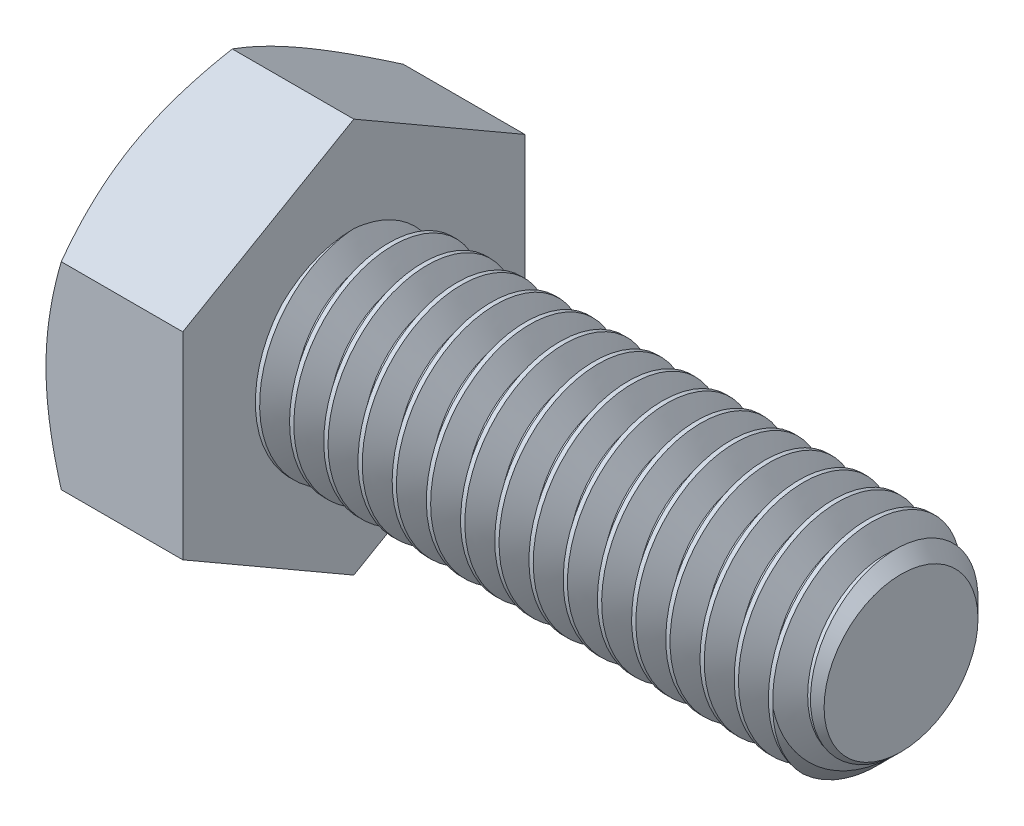
from build123d import *

# Parameters (mm, degrees)
SKETCH2_R           = 3
BOSS_EXTRUDE1_DEPTH = 16
CHAMFER1_SIZE       = 0.75
CUT_SWEEP1_PITCH    = 1
BOSS_EXTRUDE2_DEPTH = 4
SKETCH6_OUTSIDE_W   = 94.66
SKETCH6_OUTSIDE_H   = 96.208
SKETCH6_OUTSIDE_R   = 5
CUT_EXTRUDE1_DEPTH  = 22.408721108
CUT_EXTRUDE1_DRAFT  = -60
SKETCH7_W           = 0.197562976
SKETCH7_H           = 0.197562976
CUT_EXTRUDE2_DEPTH  = 0.5


with BuildPart() as part:
    # Sketch2 → Boss-Extrude1 (new body)
    with BuildSketch(Plane(origin=(10, 0, 0), x_dir=(0, 0, -1), z_dir=(1, 0, 0))):
        Circle(SKETCH2_R)
    extrude(amount=-BOSS_EXTRUDE1_DEPTH)

    # Chamfer1
    chamfer1_edges = [part.edges().sort_by_distance(p)[0] for p in [
        (10, 0, 3),
    ]]
    chamfer(chamfer1_edges, length=CHAMFER1_SIZE)

    # Cut-Sweep1: arcs per turn and ends read off the stored shape
    # Cut-Sweep1: the profile of Sketch5 profile screwed along a right-hand helix through 17 turns, 8 arcs to a turn; built about Z, then put on its axis
    cut_sweep1_z = Axis((0, 0, 0), (0, 0, 1))
    cut_sweep1_corners = [(3.0003, 0, 0.000173205), (2.350480947, 0, -0.375), (2.350480947, 0, -0.5), (3.0003, 0, -0.875173205)]
    with BuildLine(mode=Mode.PRIVATE) as cut_sweep1_profile:
        Line(cut_sweep1_corners[0], cut_sweep1_corners[1])
        Line(cut_sweep1_corners[1], cut_sweep1_corners[2])
        Line(cut_sweep1_corners[2], cut_sweep1_corners[3])
        Line(cut_sweep1_corners[3], cut_sweep1_corners[0])
    cut_sweep1_cap = Face(cut_sweep1_profile.wire())
    cut_sweep1_turn_angles = [0, 22.5, 45, 67.5, 90, 112.5, 135, 157.5, 180, 202.5, 225, 247.5, 270, 292.5, 315, 337.5, 360]
    cut_sweep1_turn_weights = [1, 0.9238795325112867, 1, 0.9238795325112867, 1, 0.9238795325112867, 1, 0.9238795325112867, 1, 0.9238795325112867, 1, 0.9238795325112867, 1, 0.9238795325112867, 1, 0.9238795325112867, 1]
    cut_sweep1_turn_rails = [Edge.make_bspline([Vector(p[0], p[1], 0).rotate(cut_sweep1_z, cut_sweep1_turn_angles[k]) / cut_sweep1_turn_weights[k] + Vector(0, 0, p[2] + CUT_SWEEP1_PITCH * cut_sweep1_turn_angles[k] / 360) for k in range(17)], [0, 0, 0, 1, 1, 2, 2, 3, 3, 4, 4, 5, 5, 6, 6, 7, 7, 8, 8, 8], 2, cut_sweep1_turn_weights) for p in cut_sweep1_corners]
    cut_sweep1_turn_sides = [Face.make_surface_from_curves(cut_sweep1_turn_rails[p[0]], cut_sweep1_turn_rails[p[1]]) for p in [(0, 1), (1, 2), (2, 3), (3, 0)]]
    cut_sweep1 = Plane(origin=(10, 0, 0), x_dir=(0, 1, 0), z_dir=(-1, 0, 0)) * Solid(Shell([*[p.moved(Location((0, 0, CUT_SWEEP1_PITCH * i))) for i in range(17) for p in cut_sweep1_turn_sides], cut_sweep1_cap, cut_sweep1_cap.rotate(cut_sweep1_z, 6120).moved(Location((0, 0, CUT_SWEEP1_PITCH * 6120 / 360)))]))
    add(cut_sweep1, mode=Mode.SUBTRACT)

    # Sketch3 → Boss-Extrude2 (add)
    with BuildSketch(Plane.ZY.offset(6)):
        Polygon((-5, -2.886751346), (0, -5.773502692), (5, -2.886751346), (5, 2.886751346), (0, 5.773502692), (-5, 2.886751346), align=None)
    extrude(amount=BOSS_EXTRUDE2_DEPTH)


with BuildPart() as cut_extrude1_tool:
    # Sketch6 outside → Cut-Extrude1 (with draft: the straight prism first)
    with BuildSketch(Plane.ZY.offset(10)):
        Rectangle(SKETCH6_OUTSIDE_W, SKETCH6_OUTSIDE_H)
        Circle(SKETCH6_OUTSIDE_R, mode=Mode.SUBTRACT)
    extrude(amount=-CUT_EXTRUDE1_DEPTH)
    # Cut-Extrude1: the draft: its side faces are tilted about the plane it starts from
    cut_extrude1_sides = [cut_extrude1_tool.faces().sort_by_distance(p)[0] for p in [
        (1.204360554, -48.104, 0),
        (1.204360554, 0, 47.33),
        (1.204360554, 48.104, 0),
        (1.204360554, 0, -47.33),
        (1.204360554, 0, -5),
    ]]
    draft(cut_extrude1_sides, Plane.ZY.offset(10), CUT_EXTRUDE1_DRAFT)


with BuildPart() as part_1:
    add(part.part)

    # Cut-Extrude1: cut by cut_extrude1_tool
    add(cut_extrude1_tool.part, mode=Mode.SUBTRACT)

    # Sketch7 → Cut-Extrude2 (cut)
    # profile 1 of 4: a face of its own
    with BuildSketch(Plane.ZY.offset(10)):
        with BuildLine():
            Line((-1.284159342, 2.5), (-1.481722318, 2.5))
            Line((-1.481722318, 2.5), (-1.481722318, 3.700812462))
            add(Edge.make_bspline(
                [(-1.481722318, 3.700812462), (-1.493098012, 3.689842005), (-1.516741144, 3.667041113), (-1.556707362, 3.634772156), (-1.601314769, 3.602066201), (-1.649984109, 3.570615769), (-1.699594268, 3.541008578), (-1.7475361, 3.514381463), (-1.793009194, 3.491848462), (-1.822962567, 3.479527328), (-1.837335675, 3.47361504)],
                knots=[0, 0, 0, 0, 0.893362401, 1.856755847, 2.901947673, 4.020460078, 5.132200827, 6.168787962, 7.121294059, 8, 8, 8, 8], degree=3))
            Line((-1.837335675, 3.47361504), (-1.837335675, 3.655743408))
            add(Edge.make_bspline(
                [(-1.837335675, 3.655743408), (-1.812648378, 3.668457416), (-1.763991177, 3.693515971), (-1.695249075, 3.736795542), (-1.631070927, 3.783712378), (-1.572519137, 3.834256092), (-1.520031188, 3.885920841), (-1.475798832, 3.938052602), (-1.438788011, 3.98874045), (-1.42021898, 4.024089603), (-1.411340508, 4.040991211)],
                knots=[0, 0, 0, 0, 1.141258006, 2.249351951, 3.335817539, 4.406819942, 5.426913362, 6.360259544, 7.215985427, 8, 8, 8, 8], degree=3))
            Line((-1.411340508, 4.040991211), (-1.284159342, 4.040991211))
            Line((-1.284159342, 4.040991211), (-1.284159342, 2.5))
        make_face()
    # profile 2 of 4: a face of its own
    with BuildSketch(Plane.ZY.offset(10)):
        with BuildLine():
            add(Edge.make_bspline(
                [(-0.790251903, 3.260000072), (-0.790052858, 3.282022251), (-0.789663013, 3.325154426), (-0.787244933, 3.388264546), (-0.783023159, 3.448197614), (-0.776721214, 3.50490158), (-0.769258531, 3.558504437), (-0.759556995, 3.608929689), (-0.748641356, 3.656290471), (-0.735544549, 3.700537418), (-0.721155446, 3.742050974), (-0.704830549, 3.780764541), (-0.686462825, 3.816637074), (-0.666954934, 3.85004059), (-0.645279941, 3.880455529), (-0.622746104, 3.908735457), (-0.597715799, 3.933843239), (-0.57122984, 3.956424902), (-0.542898213, 3.976351902), (-0.512870822, 3.993546501), (-0.481263204, 4.008728091), (-0.447472952, 4.020156788), (-0.412201546, 4.029473599), (-0.375177484, 4.036327159), (-0.336359967, 4.040367563), (-0.309833651, 4.04078098), (-0.296344464, 4.040991211)],
                knots=[0, 0, 0, 0, 1.514747001, 2.966751498, 4.343369068, 5.64627492, 6.890416844, 8.064737671, 9.177176366, 10.232018008, 11.237056675, 12.19799043, 13.119080079, 14.007588942, 14.855863561, 15.685992447, 16.491747269, 17.290132607, 18.077525251, 18.870243746, 19.668095604, 20.485086593, 21.319398728, 22.175900658, 23.072407314, 24, 24, 24, 24], degree=3))
            add(Edge.make_bspline(
                [(-0.296344464, 4.040991211), (-0.276554072, 4.040409387), (-0.237675053, 4.039266372), (-0.180911485, 4.029944144), (-0.127415481, 4.013997036), (-0.077221797, 3.992483699), (-0.031188485, 3.965157621), (0.009921203, 3.93193861), (0.045663832, 3.893175459), (0.075649327, 3.848408838), (0.101859643, 3.798873708), (0.125144312, 3.744347738), (0.146192977, 3.68489203), (0.161129567, 3.631670872), (0.171783825, 3.585728479), (0.178836097, 3.547836494), (0.184690897, 3.506950828), (0.189176465, 3.463170395), (0.192856768, 3.416544299), (0.195698897, 3.36704351), (0.197141568, 3.314544309), (0.197419873, 3.278522328), (0.197562976, 3.260000072)],
                knots=[0, 0, 0, 0, 1.134486744, 2.228744715, 3.287356444, 4.328707449, 5.352829806, 6.347195599, 7.349461267, 8.364207941, 9.428085653, 10.559314403, 11.761222316, 13.04268526, 13.726896727, 14.465273606, 15.252205015, 16.094778733, 16.988606776, 17.934225168, 18.937792761, 20, 20, 20, 20], degree=3))
            add(Edge.make_bspline(
                [(0.197562976, 3.260000072), (0.197360203, 3.238081335), (0.196964045, 3.195258767), (0.194610758, 3.132654684), (0.190134593, 3.073173782), (0.184626591, 3.016679807), (0.176294137, 2.963323573), (0.167315467, 2.912878383), (0.156211069, 2.865573301), (0.143254845, 2.821387596), (0.128663193, 2.78008763), (0.11266119, 2.74136128), (0.094937435, 2.705235008), (0.074964401, 2.672061172), (0.053655947, 2.641399446), (0.03085601, 2.613134809), (0.006081205, 2.587674071), (-0.020643434, 2.565160142), (-0.048776137, 2.544879764), (-0.07887653, 2.527515404), (-0.110812868, 2.513129332), (-0.144371773, 2.500829956), (-0.179893749, 2.491817695), (-0.217098671, 2.484918949), (-0.256123623, 2.480856468), (-0.282752541, 2.480450776), (-0.296344464, 2.480243702)],
                knots=[0, 0, 0, 0, 1.508974709, 2.94807912, 4.311757619, 5.615040294, 6.854280449, 8.028314546, 9.141715822, 10.197470207, 11.196696834, 12.155719058, 13.080757287, 13.963948316, 14.818758719, 15.649605906, 16.461113142, 17.260189315, 18.052359509, 18.845763934, 19.647754795, 20.461145776, 21.303032214, 22.167241874, 23.064524267, 24, 24, 24, 24], degree=3))
            add(Edge.make_bspline(
                [(-0.296344464, 2.480243702), (-0.31416505, 2.480752036), (-0.348910289, 2.481743145), (-0.399653148, 2.488477126), (-0.447278028, 2.500329248), (-0.492186617, 2.516224614), (-0.533874131, 2.537485582), (-0.572539611, 2.563353701), (-0.608960011, 2.593227122), (-0.629925808, 2.616796566), (-0.64053621, 2.628724626)],
                knots=[0, 0, 0, 0, 1.10322584, 2.150986741, 3.161425019, 4.136713905, 5.093944212, 6.049774532, 7.013026876, 8, 8, 8, 8], degree=3))
            add(Edge.make_bspline(
                [(-0.64053621, 2.628724626), (-0.652749028, 2.646341795), (-0.677932381, 2.682669151), (-0.707407312, 2.744610663), (-0.733699472, 2.81279957), (-0.754333998, 2.888573732), (-0.770495975, 2.971330072), (-0.782168957, 3.061230974), (-0.788774716, 3.158237599), (-0.789748392, 3.225313505), (-0.790251903, 3.260000072)],
                knots=[0, 0, 0, 0, 0.779365345, 1.607084704, 2.489375761, 3.438383567, 4.461919411, 5.557722155, 6.737039282, 8, 8, 8, 8], degree=3))
        make_face()
        with BuildLine():
            add(Edge.make_bspline(
                [(-0.592688927, 3.260617457), (-0.592492763, 3.230978591), (-0.592117261, 3.174243246), (-0.588194178, 3.093187016), (-0.581440751, 3.020063233), (-0.57251228, 2.954973141), (-0.560723083, 2.897828693), (-0.545920352, 2.84877551), (-0.529234153, 2.807224843), (-0.508585298, 2.77369168), (-0.485977083, 2.746357261), (-0.462635646, 2.722848776), (-0.438011843, 2.702867102), (-0.412266343, 2.686206461), (-0.384999685, 2.673592119), (-0.356510025, 2.664449215), (-0.326791165, 2.659187614), (-0.30655127, 2.658431621), (-0.296344464, 2.658050381)],
                knots=[0, 0, 0, 0, 1.89448813, 3.626469325, 5.185477471, 6.587276848, 7.82441448, 8.910550357, 9.859733512, 10.6775885, 11.416198291, 12.123144072, 12.791880183, 13.439617036, 14.078171869, 14.70637855, 15.347637704, 16, 16, 16, 16], degree=3))
            add(Edge.make_bspline(
                [(-0.296344464, 2.658050381), (-0.286140213, 2.658439952), (-0.265905387, 2.659212463), (-0.236117858, 2.66435804), (-0.207739045, 2.673971614), (-0.180513042, 2.686541403), (-0.154580415, 2.702822298), (-0.130077548, 2.722879447), (-0.106613153, 2.746373973), (-0.084106493, 2.774026105), (-0.063614954, 2.807714303), (-0.046615742, 2.849231123), (-0.032043703, 2.898370213), (-0.020189817, 2.955485547), (-0.011224514, 3.020472726), (-0.00451192, 3.093393697), (-0.000562582, 3.174345633), (-0.000193277, 3.230978457), (0, 3.260617457)],
                knots=[0, 0, 0, 0, 0.652509534, 1.29391342, 1.924290653, 2.562989607, 3.207355802, 3.876242846, 4.583348185, 5.32723334, 6.150888545, 7.094226006, 8.186903555, 9.424320409, 10.81992305, 12.379283064, 14.105084285, 16, 16, 16, 16], degree=3))
            add(Edge.make_bspline(
                [(0, 3.260617457), (-0.000187089, 3.289639765), (-0.000545544, 3.345245408), (-0.00459674, 3.424740087), (-0.010945329, 3.496636517), (-0.01962919, 3.56100098), (-0.03117004, 3.6177636), (-0.045167517, 3.667045216), (-0.061847603, 3.708740728), (-0.081680166, 3.743268967), (-0.103757778, 3.77159149), (-0.126819935, 3.796107098), (-0.151443196, 3.816956825), (-0.178063809, 3.833682782), (-0.205823744, 3.847176663), (-0.235360851, 3.856463495), (-0.266384805, 3.862169035), (-0.287676143, 3.862842166), (-0.298505309, 3.863184533)],
                knots=[0, 0, 0, 0, 1.850066095, 3.544656626, 5.0727657, 6.45041401, 7.682899467, 8.762389858, 9.712573485, 10.538438529, 11.291566246, 11.996865408, 12.681389046, 13.341983376, 13.996294293, 14.643563182, 15.31009126, 16, 16, 16, 16], degree=3))
            add(Edge.make_bspline(
                [(-0.298505309, 3.863184533), (-0.308711474, 3.862916661), (-0.328836725, 3.862388453), (-0.358302727, 3.857346709), (-0.386227312, 3.84891579), (-0.412930404, 3.837495291), (-0.437745374, 3.822125556), (-0.461656324, 3.804180295), (-0.483543356, 3.782315999), (-0.49673229, 3.765970592), (-0.503476896, 3.757611818)],
                knots=[0, 0, 0, 0, 1.021318143, 2.013908504, 2.982026795, 3.937174072, 4.91255697, 5.897578595, 6.924855925, 8, 8, 8, 8], degree=3))
            add(Edge.make_bspline(
                [(-0.503476896, 3.757611818), (-0.510819714, 3.745335366), (-0.5263262, 3.719410087), (-0.543677057, 3.674350882), (-0.559004117, 3.622856788), (-0.57162337, 3.56413553), (-0.580752514, 3.49828784), (-0.58795962, 3.425390186), (-0.591703443, 3.345340795), (-0.592351369, 3.289637751), (-0.592688927, 3.260617457)],
                knots=[0, 0, 0, 0, 0.671104906, 1.417232262, 2.260109084, 3.195198885, 4.23592645, 5.382417421, 6.636286093, 8, 8, 8, 8], degree=3))
        make_face(mode=Mode.SUBTRACT)
    # profile 3 of 4: a face of its own
    with BuildSketch(Plane.ZY.offset(10)):
        with Locations((0.592688927, 2.598781488)):
            Rectangle(SKETCH7_W, SKETCH7_H)
    # profile 4 of 4: a face of its own
    with BuildSketch(Plane.ZY.offset(10)):
        with BuildLine():
            Line((1.007571176, 2.875369654), (1.205134152, 2.895125952))
            add(Edge.make_bspline(
                [(1.205134152, 2.895125952), (1.206920239, 2.885003602), (1.210372897, 2.865436243), (1.218164458, 2.837549402), (1.226067012, 2.811547623), (1.236268145, 2.788010165), (1.246891881, 2.766297683), (1.258922971, 2.746627755), (1.272575767, 2.729395444), (1.291855309, 2.709202247), (1.319210172, 2.688130304), (1.357127719, 2.671061208), (1.398840582, 2.65958445), (1.428236664, 2.658573426), (1.443444492, 2.658050381)],
                knots=[0, 0, 0, 0, 0.994516507, 1.922484754, 2.80151264, 3.623050913, 4.402748861, 5.140924173, 5.850441436, 6.526872911, 7.841975818, 9.161260782, 10.53140107, 12, 12, 12, 12], degree=3))
            add(Edge.make_bspline(
                [(1.443444492, 2.658050381), (1.456751488, 2.658529578), (1.482941721, 2.659472712), (1.521127946, 2.666783962), (1.557442454, 2.678496432), (1.591253108, 2.695301374), (1.622436856, 2.71575252), (1.649674808, 2.7400526), (1.673330676, 2.767155041), (1.692759492, 2.798382253), (1.709342511, 2.83404897), (1.725011258, 2.8746088), (1.739833634, 2.920760517), (1.753006889, 2.971915473), (1.764802895, 3.026206092), (1.773081217, 3.082402208), (1.778174547, 3.13941128), (1.778719417, 3.177774463), (1.778992858, 3.197026874)],
                knots=[0, 0, 0, 0, 0.897794352, 1.766998465, 2.614902619, 3.466100941, 4.308008728, 5.124841802, 5.922729683, 6.728261092, 7.598214292, 8.574707161, 9.662086263, 10.868425066, 12.139522319, 13.41071447, 14.70057738, 16, 16, 16, 16], degree=3))
            add(Edge.make_bspline(
                [(1.778992858, 3.197026874), (1.778899344, 3.202274865), (1.778675616, 3.214830375), (1.778290769, 3.227382036), (1.778066782, 3.234687316)],
                knots=[0, 0, 0, 0, 0.835966126, 2, 2, 2, 2], degree=3))
            add(Edge.make_bspline(
                [(1.778066782, 3.234687316), (1.768542584, 3.22022413), (1.749509536, 3.191321063), (1.714445959, 3.152529649), (1.674332612, 3.118121138), (1.629778386, 3.088362715), (1.58188343, 3.063940569), (1.531480967, 3.046194448), (1.479005485, 3.035236452), (1.443291513, 3.034030076), (1.425231655, 3.033420035)],
                knots=[0, 0, 0, 0, 0.978840568, 1.956103883, 2.947027447, 3.962820877, 4.980997961, 5.980964245, 6.979013046, 8, 8, 8, 8], degree=3))
            add(Edge.make_bspline(
                [(1.425231655, 3.033420035), (1.410181713, 3.033809962), (1.380555612, 3.034577542), (1.337158587, 3.041399547), (1.295419155, 3.051630137), (1.255732843, 3.067119745), (1.21748219, 3.086276405), (1.181068826, 3.109789736), (1.146436643, 3.137627733), (1.114033143, 3.169443767), (1.084462099, 3.2049069), (1.05838385, 3.243153184), (1.036728508, 3.28436963), (1.018710514, 3.328041798), (1.004807734, 3.374591649), (0.995147123, 3.423910112), (0.988649898, 3.475808926), (0.98809691, 3.511357846), (0.987814879, 3.529488319)],
                knots=[0, 0, 0, 0, 0.975490236, 1.920271282, 2.842894855, 3.757591483, 4.67685385, 5.613562631, 6.563069669, 7.554119451, 8.55387214, 9.553424333, 10.550567425, 11.568071726, 12.613215376, 13.695622473, 14.824733476, 16, 16, 16, 16], degree=3))
            add(Edge.make_bspline(
                [(0.987814879, 3.529488319), (0.988237289, 3.548232953), (0.989063596, 3.584900708), (0.995305351, 3.63851352), (1.005631769, 3.689304987), (1.020691426, 3.737178163), (1.039315186, 3.782440645), (1.062799025, 3.824766099), (1.090238676, 3.864335583), (1.12179809, 3.900767612), (1.1564816, 3.933457226), (1.193305446, 3.962633275), (1.232749472, 3.986615849), (1.274057373, 4.006611333), (1.317541757, 4.022064144), (1.363128302, 4.033233279), (1.410943155, 4.039786979), (1.443527149, 4.040584988), (1.460113868, 4.040991211)],
                knots=[0, 0, 0, 0, 1.151671969, 2.252870106, 3.311924673, 4.331900944, 5.332425074, 6.314476151, 7.300265758, 8.286521684, 9.270545387, 10.225535917, 11.167946231, 12.101233205, 13.04124339, 13.998220545, 14.981004193, 16, 16, 16, 16], degree=3))
            add(Edge.make_bspline(
                [(1.460113868, 4.040991211), (1.472160605, 4.04074757), (1.49610549, 4.040263292), (1.53174045, 4.036565994), (1.56653158, 4.029901008), (1.600705712, 4.021487923), (1.633686425, 4.009809927), (1.666109474, 3.996305519), (1.697583789, 3.979788608), (1.728292766, 3.961006809), (1.758043531, 3.940290273), (1.78541595, 3.916489215), (1.811504082, 3.891230711), (1.835777069, 3.863722031), (1.857467159, 3.833538628), (1.878046883, 3.801747632), (1.896524197, 3.767655353), (1.913374225, 3.731215619), (1.928371403, 3.691678329), (1.940882807, 3.648169752), (1.951607872, 3.600539191), (1.960537546, 3.548723511), (1.967159045, 3.492759655), (1.972032081, 3.432730793), (1.975222249, 3.368591267), (1.975491252, 3.324417814), (1.975629758, 3.301673513)],
                knots=[0, 0, 0, 0, 0.850689348, 1.69088598, 2.526071361, 3.350886897, 4.173587108, 4.994166539, 5.82944675, 6.680632524, 7.535501428, 8.385942454, 9.238956306, 10.098905971, 10.972410977, 11.861345628, 12.77184846, 13.708225841, 14.694799433, 15.754852217, 16.902446579, 18.141290626, 19.466225842, 20.880733292, 22.39393263, 24, 24, 24, 24], degree=3))
            add(Edge.make_bspline(
                [(1.975629758, 3.301673513), (1.975490325, 3.277900399), (1.975218576, 3.231567557), (1.972003363, 3.163933366), (1.967132776, 3.099998865), (1.960506598, 3.039722069), (1.951514674, 2.983194972), (1.940827057, 2.930427456), (1.928222834, 2.881322105), (1.913411036, 2.835874606), (1.896572884, 2.793562676), (1.878123243, 2.753865304), (1.857460667, 2.716841197), (1.834817321, 2.682419349), (1.81048396, 2.650539597), (1.784080657, 2.621287341), (1.755598839, 2.594751007), (1.725401557, 2.570631953), (1.69353413, 2.54937701), (1.660430384, 2.530622167), (1.625716723, 2.515258667), (1.589750014, 2.502655004), (1.552594169, 2.492248635), (1.513946549, 2.485236805), (1.473985704, 2.481265544), (1.446951668, 2.480587277), (1.433257651, 2.480243702)],
                knots=[0, 0, 0, 0, 1.538356107, 2.998194159, 4.380716326, 5.687456969, 6.921258146, 8.08355215, 9.170518603, 10.200253214, 11.174652363, 12.115998813, 13.031191965, 13.915860606, 14.780247615, 15.624154577, 16.462764255, 17.29681422, 18.1223677, 18.939254916, 19.756006416, 20.575278551, 21.404021733, 22.250368457, 23.113728878, 24, 24, 24, 24], degree=3))
            add(Edge.make_bspline(
                [(1.433257651, 2.480243702), (1.418732748, 2.480494839), (1.390314716, 2.480986189), (1.348827314, 2.486152771), (1.309305056, 2.494007659), (1.271862965, 2.505603334), (1.236220636, 2.519877298), (1.202986414, 2.538118612), (1.171569683, 2.559163632), (1.142358031, 2.583436747), (1.115693486, 2.610848821), (1.091567168, 2.640724272), (1.070415495, 2.673450039), (1.052349162, 2.70883318), (1.036346581, 2.746576015), (1.023940229, 2.787184652), (1.013861262, 2.83028456), (1.00970173, 2.860098607), (1.007571176, 2.875369654)],
                knots=[0, 0, 0, 0, 1.08199657, 2.11693069, 3.111083497, 4.081436044, 5.034173265, 5.967546613, 6.901297947, 7.84883568, 8.792454994, 9.747011506, 10.706361727, 11.690764787, 12.70483191, 13.757514363, 14.851376857, 16, 16, 16, 16], degree=3))
        make_face()
        with BuildLine():
            add(Edge.make_bspline(
                [(1.778066782, 3.533810009), (1.777844584, 3.546167498), (1.777412091, 3.570220558), (1.773622923, 3.605313673), (1.767526176, 3.638360963), (1.758968941, 3.669552455), (1.747347963, 3.698557507), (1.733885852, 3.72605331), (1.717423045, 3.751277762), (1.698847657, 3.774570528), (1.678386493, 3.79540537), (1.656104474, 3.813571489), (1.632419371, 3.829143971), (1.606762975, 3.84138813), (1.579978695, 3.851477273), (1.551423134, 3.858071145), (1.521489215, 3.862690284), (1.500880058, 3.863017562), (1.490365698, 3.863184533)],
                knots=[0, 0, 0, 0, 1.20361398, 2.342757417, 3.433960756, 4.474970456, 5.487648377, 6.473933575, 7.452701285, 8.415527761, 9.372491588, 10.291530068, 11.211879743, 12.12647906, 13.055739058, 13.994253148, 14.97671008, 16, 16, 16, 16], degree=3))
            add(Edge.make_bspline(
                [(1.490365698, 3.863184533), (1.479550713, 3.862856809), (1.458245164, 3.862211193), (1.427017644, 3.858053397), (1.397402188, 3.850092498), (1.36919886, 3.839532546), (1.342094419, 3.826470071), (1.317074221, 3.809354236), (1.29309033, 3.789957753), (1.271104705, 3.76745525), (1.251021561, 3.742783687), (1.233326098, 3.716174633), (1.218424276, 3.687615052), (1.206512128, 3.657224018), (1.19677715, 3.625266419), (1.190089912, 3.591456506), (1.18597516, 3.555830273), (1.185579924, 3.531454958), (1.185377855, 3.518992786)],
                knots=[0, 0, 0, 0, 1.007165334, 1.984118292, 2.925321257, 3.856078893, 4.785899085, 5.718627206, 6.671847665, 7.654235469, 8.641842333, 9.630378272, 10.624608936, 11.635186472, 12.665777387, 13.731187195, 14.840042241, 16, 16, 16, 16], degree=3))
            add(Edge.make_bspline(
                [(1.185377855, 3.518992786), (1.185564481, 3.50786364), (1.185930382, 3.48604371), (1.190287864, 3.454199511), (1.196100099, 3.423807131), (1.2053659, 3.395176801), (1.216528497, 3.367892863), (1.231036441, 3.342581934), (1.247371005, 3.318487167), (1.266510109, 3.29641574), (1.287668429, 3.276393087), (1.31077761, 3.258941189), (1.335545758, 3.244002062), (1.36220298, 3.231978182), (1.390589415, 3.222718025), (1.420641701, 3.215900682), (1.452490468, 3.211840104), (1.474301842, 3.211433897), (1.485426624, 3.211226713)],
                knots=[0, 0, 0, 0, 1.102204012, 2.160993585, 3.181057555, 4.164839289, 5.138418409, 6.097303793, 7.050641095, 8.019669129, 8.986440483, 9.932879371, 10.884360123, 11.847412593, 12.824617322, 13.839006415, 14.897795988, 16, 16, 16, 16], degree=3))
            add(Edge.make_bspline(
                [(1.485426624, 3.211226713), (1.495831895, 3.211435921), (1.516311795, 3.211847691), (1.546312698, 3.215925579), (1.574819195, 3.222755565), (1.601959278, 3.232041219), (1.627688956, 3.244060942), (1.651835213, 3.259118787), (1.674864814, 3.276371256), (1.696102673, 3.296529924), (1.715513299, 3.318849511), (1.732299881, 3.343550515), (1.746634721, 3.37018436), (1.7579177, 3.399066744), (1.76695483, 3.429842075), (1.773317571, 3.462705196), (1.777484418, 3.497585953), (1.777869725, 3.521552704), (1.778066782, 3.533810009)],
                knots=[0, 0, 0, 0, 1.017004716, 2.00169281, 2.953445817, 3.879374072, 4.80207141, 5.723561102, 6.657273834, 7.611045633, 8.581233951, 9.544037932, 10.525327521, 11.53237926, 12.57032081, 13.657564536, 14.802009319, 16, 16, 16, 16], degree=3))
        make_face(mode=Mode.SUBTRACT)
    extrude(amount=-CUT_EXTRUDE2_DEPTH, mode=Mode.SUBTRACT)


solid = part_1.part
